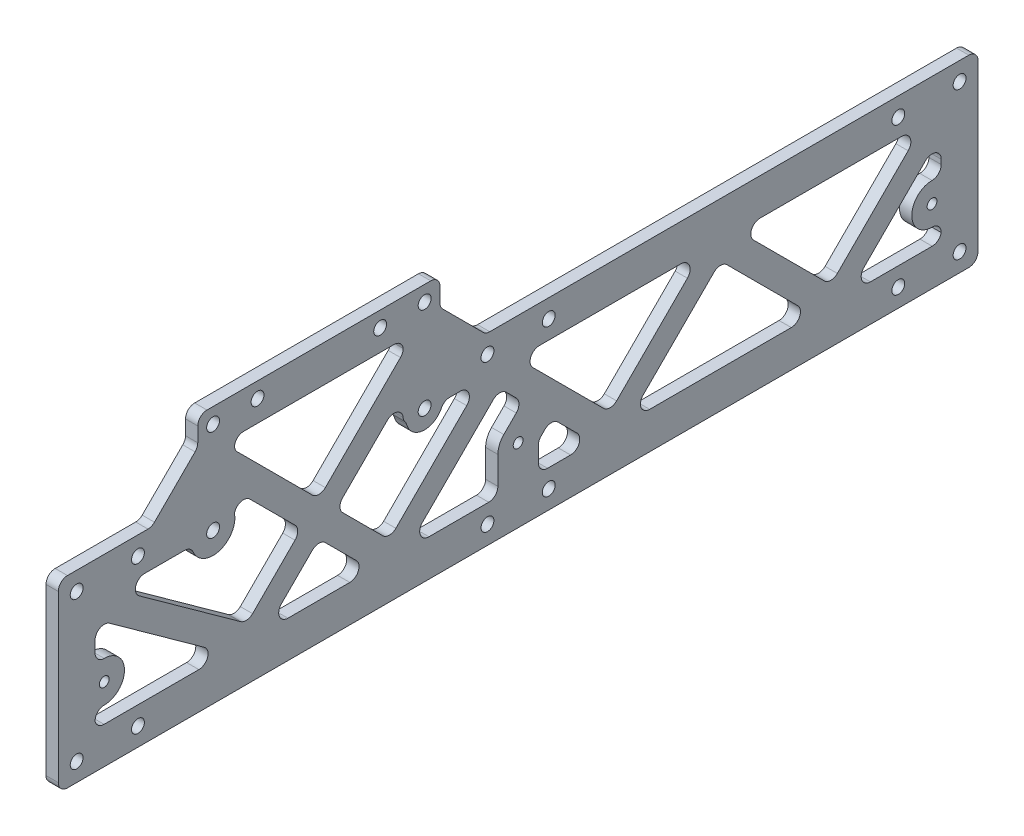
from build123d import *

# Parameters (mm, degrees)
SKETCH_1_W          = 300
SKETCH_1_H          = 60
SKETCH_1_R          = 1.6
SKETCH_1_R_2        = 2.1
EXTRUDE_1_DEPTH     = 4
SKETCH_2_W          = 79
SKETCH_2_H          = 24
SKETCH_2_R          = 2.1
EXTRUDE_2_DEPTH     = 4
SKETCH_2_4_R        = 2.1
CUT_EXTRUDE_1_DEPTH = 4
CUT_EXTRUDE_2_DEPTH = 10
FILLET_1_R          = 3
FILLET_2_R          = 3
FILLET_3_R          = 3
FILLET_4_R          = 3
FILLET_5_R          = 3
CHAMFER_1_SIZE      = 15
FILLET_6_R          = 3
SKETCH_4_R          = 2.1
CUT_EXTRUDE_3_DEPTH = 10


with BuildPart() as part:
    # 草图1 → 凸台-拉伸1 (new body)
    with BuildSketch(Plane(origin=(0, 0, 0), x_dir=(0, 0, -1), z_dir=(1, 0, 0))):
        with Locations((135, 6)):
            Rectangle(SKETCH_1_W, SKETCH_1_H)
        Circle(SKETCH_1_R, mode=Mode.SUBTRACT)
        with Locations((135, 0)):
            Circle(SKETCH_1_R, mode=Mode.SUBTRACT)
        with Locations((270, 0)):
            Circle(SKETCH_1_R, mode=Mode.SUBTRACT)
        with Locations((-9, -18)):
            Circle(SKETCH_1_R_2, mode=Mode.SUBTRACT)
        with Locations((11, -18)):
            Circle(SKETCH_1_R_2, mode=Mode.SUBTRACT)
        with Locations((125, -18)):
            Circle(SKETCH_1_R_2, mode=Mode.SUBTRACT)
        with Locations((145, -18)):
            Circle(SKETCH_1_R_2, mode=Mode.SUBTRACT)
        with Locations((259, -18)):
            Circle(SKETCH_1_R_2, mode=Mode.SUBTRACT)
        with Locations((279, -18)):
            Circle(SKETCH_1_R_2, mode=Mode.SUBTRACT)
        with Locations(Location((279, 30, 0), (0, 0, 180))):
            Circle(SKETCH_1_R_2, mode=Mode.SUBTRACT)
        with Locations(Location((259, 30, 0), (0, 0, 180))):
            Circle(SKETCH_1_R_2, mode=Mode.SUBTRACT)
        with Locations(Location((145, 30, 0), (0, 0, 180))):
            Circle(SKETCH_1_R_2, mode=Mode.SUBTRACT)
        with Locations(Location((125, 30, 0), (0, 0, 180))):
            Circle(SKETCH_1_R_2, mode=Mode.SUBTRACT)
        with Locations(Location((11, 30, 0), (0, 0, 180))):
            Circle(SKETCH_1_R_2, mode=Mode.SUBTRACT)
        with Locations(Location((-9, 30, 0), (0, 0, 180))):
            Circle(SKETCH_1_R_2, mode=Mode.SUBTRACT)
    extrude(amount=EXTRUDE_1_DEPTH)

    # 草图2 → 凸台-拉伸2 (add)
    with BuildSketch(Plane.ZY):
        with Locations((-70, 48)):
            Rectangle(SKETCH_2_W, SKETCH_2_H)
        with Locations((-104.5, 55)):
            Circle(SKETCH_2_R, mode=Mode.SUBTRACT)
        with Locations((-35.5, 55)):
            Circle(SKETCH_2_R, mode=Mode.SUBTRACT)
    extrude(amount=-EXTRUDE_2_DEPTH)

    # 草图2<4> → 切除-拉伸1 (cut)
    with BuildSketch(Plane.ZY):
        with Locations((-104.5, 25)):
            Circle(SKETCH_2_4_R)
        with Locations((-35.5, 25)):
            Circle(SKETCH_2_4_R)
    extrude(amount=-CUT_EXTRUDE_1_DEPTH, mode=Mode.SUBTRACT)

    # 草图3 → 切除-拉伸2 (cut)
    with BuildSketch(Plane.ZY):
        with BuildLine():
            Line((-242.656854249, -12), (-273, 18.343145751))
            Line((-273, 18.343145751), (-273, 5.878775383))
            ThreePointArc((-273, 5.878775383), (-263.4, 0), (-273, -5.878775383))
            Line((-273, -5.878775383), (-273, -12))
            Line((-273, -12), (-242.656854249, -12))
        make_face()
        Polygon((-201, 18.343145751), (-231.343145751, -12), (-170.656854249, -12), align=None)
        Polygon((-206.656854249, 24), (-267.343145751, 24), (-237, -6.343145751), align=None)
        Polygon((-145.838477631, 1.504668119), (-159.343145751, -12), (-141.6, -12), (-141.6, -2.733809512), align=None)
        Polygon((-134.656854249, 24), (-195.343145751, 24), (-165, -6.343145751), align=None)
        with BuildLine():
            Line((-129, 18.343145751), (-136.504668119, 10.838477631))
            Line((-136.504668119, 10.838477631), (-130.333095244, 4.666904756))
            ThreePointArc((-130.333095244, 4.666904756), (-128.902395085, 2.525710654), (-128.4, 0))
            Line((-128.4, 0), (-128.4, -12))
            Line((-128.4, -12), (-98.656854249, -12))
            Line((-98.656854249, -12), (-129, 18.343145751))
        make_face()
        with BuildLine():
            Line((-110.517474553, 24), (-123.343145751, 24))
            Line((-123.343145751, 24), (-93, -6.343145751))
            Line((-93, -6.343145751), (-75.656854249, 11))
            Line((-75.656854249, 11), (-97.5, 32.843145751))
            Line((-97.5, 32.843145751), (-97.5, 24))
            Line((-97.5, 24), (-98.482525447, 24))
            ThreePointArc((-98.482525447, 24), (-104.5, 18.9), (-110.517474553, 24))
        make_face()
        Polygon((-70, 5.343145751), (-87.343145751, -12), (-52.656854249, -12), align=None)
        Polygon((-97.5, 44.156854249), (-70, 16.656854249), (-42.5, 44.156854249), (-42.5, 48), (-97.5, 48), align=None)
        with BuildLine():
            Line((-42.5, 32.843145751), (-64.343145751, 11))
            Line((-64.343145751, 11), (-46.57679112, -6.76635463))
            Line((-46.57679112, -6.76635463), (-3.845743023, 24))
            Line((-3.845743023, 24), (-28.470775292, 24))
            ThreePointArc((-28.470775292, 24), (-36.593814712, 17.984761631), (-42.5, 26.187434209))
            Line((-42.5, 26.187434209), (-42.5, 32.843145751))
        make_face()
        with BuildLine():
            Line((3, 19.071065024), (-40.154256977, -12))
            Line((-40.154256977, -12), (3, -12))
            Line((3, -12), (3, -5.878775383))
            ThreePointArc((3, -5.878775383), (-6.6, 0), (3, 5.878775383))
            Line((3, 5.878775383), (3, 19.071065024))
        make_face()
    extrude(amount=-CUT_EXTRUDE_2_DEPTH, mode=Mode.SUBTRACT)

    # 圆角1
    fillet_1_edges = [part.edges().sort_by_distance(p)[0] for p in [
        (2, 26.187434209, -42.5),
        (2, -6.76635463, -46.57679112),
        (2, -5.878775383, 3),
        (2, 19.071065024, 3),
        (2, 24, -206.656854249),
    ]]
    fillet(fillet_1_edges, radius=FILLET_1_R)

    # 圆角2
    # the kernel refuses this fillet: 3 mm, written as the material it adds along each edge
    with BuildSketch(Plane(origin=(0, -12, 3), x_dir=(0, 1.0, -1.5720758028687154e-12), z_dir=(1, 0, 0))) as fillet_2_piece_1:
        with BuildLine():
            CenterArc((3, -2.939387691), FILLET_2_R, 101.536959033, 78.463040967)
            Line((0, -2.939387691), (-0.06, -2.939387691))
            Line((-0.06, -2.939387691), (-0.06, 0))
            Line((-0.06, 0), (0, 0.06))
            ThreePointArc((0, 0.06), (1.2, 0.06), (2.388, 0.058787754))
            Line((2.388, 0.058787754), (2.4, 0))
        make_face()
    extrude(amount=4)
    with BuildSketch(Plane(origin=(0, 44.156854249, -42.5), x_dir=(0, 1, 0), z_dir=(1, 0, 0))) as fillet_2_piece_2:
        with BuildLine():
            CenterArc((FILLET_2_R * 0.414213562373, -FILLET_2_R), FILLET_2_R, 90, 45)
            Line((-FILLET_2_R * 0.292893218813, -FILLET_2_R * 0.292893218813), (-FILLET_2_R * 0.307035354437, -FILLET_2_R * 0.27875108319))
            Line((-FILLET_2_R * 0.307035354437, -FILLET_2_R * 0.27875108319), (-FILLET_2_R * 0.00828427124746, FILLET_2_R * 0.02))
            Line((-FILLET_2_R * 0.00828427124746, FILLET_2_R * 0.02), (FILLET_2_R * 0.414213562373, FILLET_2_R * 0.02))
            Line((FILLET_2_R * 0.414213562373, FILLET_2_R * 0.02), (FILLET_2_R * 0.414213562373, 0))
        make_face()
    extrude(amount=4)
    with BuildSketch(Plane(origin=(0, 18.343145751, -273), x_dir=(0, -1, 0), z_dir=(1, 0, 0))) as fillet_2_piece_3:
        with BuildLine():
            CenterArc((FILLET_2_R * 2.41421356237, -FILLET_2_R), FILLET_2_R, 90, 135)
            Line((FILLET_2_R * 1.70710678119, -FILLET_2_R * 1.70710678119), (FILLET_2_R * 1.69296464556, -FILLET_2_R * 1.72124891681))
            Line((FILLET_2_R * 1.69296464556, -FILLET_2_R * 1.72124891681), (-FILLET_2_R * 0.0141421356237, -FILLET_2_R * 0.0141421356237))
            Line((-FILLET_2_R * 0.0141421356237, -FILLET_2_R * 0.0141421356237), (0, FILLET_2_R * 0.02))
            Line((0, FILLET_2_R * 0.02), (FILLET_2_R * 2.41421356237, FILLET_2_R * 0.02))
            Line((FILLET_2_R * 2.41421356237, FILLET_2_R * 0.02), (FILLET_2_R * 2.41421356237, 0))
        make_face()
    extrude(amount=4)
    with BuildSketch(Plane(origin=(0, -12, -40.154256977), x_dir=(0, 0, 1), z_dir=(1, 0, 0))) as fillet_2_piece_4:
        with BuildLine():
            CenterArc((FILLET_2_R * 3.10032464453, -FILLET_2_R), FILLET_2_R, 90, 144.246112746)
            Line((FILLET_2_R * 2.51601991868, -FILLET_2_R * 1.81153434145), (FILLET_2_R * 2.50433382417, -FILLET_2_R * 1.82776502828))
            Line((FILLET_2_R * 2.50433382417, -FILLET_2_R * 1.82776502828), (-FILLET_2_R * 0.0116860945169, -FILLET_2_R * 0.016230686829))
            Line((-FILLET_2_R * 0.0116860945169, -FILLET_2_R * 0.016230686829), (0, FILLET_2_R * 0.02))
            Line((0, FILLET_2_R * 0.02), (FILLET_2_R * 3.10032464453, FILLET_2_R * 0.02))
            Line((FILLET_2_R * 3.10032464453, FILLET_2_R * 0.02), (FILLET_2_R * 3.10032464453, 0))
        make_face()
    extrude(amount=4)
    with BuildSketch(Plane(origin=(0, 5.878775383, -273), x_dir=(0, 0.23374821621750477, 0.9722971620935313), z_dir=(1, 0, 0))) as fillet_2_piece_5:
        with BuildLine():
            CenterArc((3.786721103, -2.916891486), FILLET_2_R, 103.517845895, 90)
            Line((0.869829616, -3.618136135), (0.811491787, -3.632161028))
            Line((0.811491787, -3.632161028), (-0.05833783, -0.014024893))
            Line((-0.05833783, -0.014024893), (0.014024893, 0.05833783))
            ThreePointArc((0.014024893, 0.05833783), (1.542738227, -0.12283873), (3.071451561, 0.05833783))
            Line((3.071451561, 0.05833783), (3.085476454, 0))
        make_face()
    extrude(amount=4)
    with BuildSketch(Plane(origin=(0, 44.156854249, -97.5), x_dir=(0, 1, 0), z_dir=(1, 0, 0))) as fillet_2_piece_6:
        with BuildLine():
            CenterArc((FILLET_2_R * 0.414213562373, FILLET_2_R), FILLET_2_R, 225, 45)
            Line((-FILLET_2_R * 0.292893218813, FILLET_2_R * 0.292893218813), (-FILLET_2_R * 0.307035354437, FILLET_2_R * 0.27875108319))
            Line((-FILLET_2_R * 0.307035354437, FILLET_2_R * 0.27875108319), (-FILLET_2_R * 0.00828427124746, -FILLET_2_R * 0.02))
            Line((-FILLET_2_R * 0.00828427124746, -FILLET_2_R * 0.02), (FILLET_2_R * 0.414213562373, -FILLET_2_R * 0.02))
            Line((FILLET_2_R * 0.414213562373, -FILLET_2_R * 0.02), (FILLET_2_R * 0.414213562373, 0))
        make_face()
    extrude(amount=4)

    # 圆角3
    # the kernel refuses this fillet: 3 mm, written as the material it adds along each edge
    with BuildSketch(Plane(origin=(0, 48, -42.5), x_dir=(0, 0, -1), z_dir=(1, 0, 0))) as fillet_3_piece_1:
        with BuildLine():
            CenterArc((2.973281654, -3), FILLET_3_R, 90, 82.347477131)
            Line((0, -2.600505063), (-0.059465633, -2.592515165))
            ThreePointArc((-0.059465633, -2.592515165), (-0.06, -1.300252532), (-0.06, 0))
            Line((-0.06, 0), (0, 0.06))
            Line((0, 0.06), (2.973281654, 0.06))
            Line((2.973281654, 0.06), (2.973281654, 0))
        make_face()
    extrude(amount=4)
    with BuildSketch(Plane(origin=(0, 11, -75.656854249), x_dir=(0, 0.7071067811865517, -0.7071067811865434), z_dir=(1, 0, 0))) as fillet_3_piece_2:
        with BuildLine():
            CenterArc((FILLET_3_R, -FILLET_3_R), FILLET_3_R, 90, 90)
            Line((0, -FILLET_3_R), (-FILLET_3_R * 0.02, -FILLET_3_R))
            Line((-FILLET_3_R * 0.02, -FILLET_3_R), (-FILLET_3_R * 0.02, FILLET_3_R * 0.02))
            Line((-FILLET_3_R * 0.02, FILLET_3_R * 0.02), (FILLET_3_R, FILLET_3_R * 0.02))
            Line((FILLET_3_R, FILLET_3_R * 0.02), (FILLET_3_R, 0))
        make_face()
    extrude(amount=4)
    with BuildSketch(Plane(origin=(0, -12, -242.656854249), x_dir=(0, 0, -1), z_dir=(1, 0, 0))) as fillet_3_piece_3:
        with BuildLine():
            CenterArc((FILLET_3_R * 2.41421356237, FILLET_3_R), FILLET_3_R, 135, 135)
            Line((FILLET_3_R * 1.70710678119, FILLET_3_R * 1.70710678119), (FILLET_3_R * 1.69296464556, FILLET_3_R * 1.72124891681))
            Line((FILLET_3_R * 1.69296464556, FILLET_3_R * 1.72124891681), (-FILLET_3_R * 0.0141421356237, FILLET_3_R * 0.0141421356237))
            Line((-FILLET_3_R * 0.0141421356237, FILLET_3_R * 0.0141421356237), (0, -FILLET_3_R * 0.02))
            Line((0, -FILLET_3_R * 0.02), (FILLET_3_R * 2.41421356237, -FILLET_3_R * 0.02))
            Line((FILLET_3_R * 2.41421356237, -FILLET_3_R * 0.02), (FILLET_3_R * 2.41421356237, 0))
        make_face()
    extrude(amount=4)
    with BuildSketch(Plane(origin=(0, 32.843145751, -97.5), x_dir=(0, -1, 0), z_dir=(1, 0, 0))) as fillet_3_piece_4:
        with BuildLine():
            CenterArc((FILLET_3_R * 2.41421356237, -FILLET_3_R), FILLET_3_R, 90, 135)
            Line((FILLET_3_R * 1.70710678119, -FILLET_3_R * 1.70710678119), (FILLET_3_R * 1.69296464556, -FILLET_3_R * 1.72124891681))
            Line((FILLET_3_R * 1.69296464556, -FILLET_3_R * 1.72124891681), (-FILLET_3_R * 0.0141421356237, -FILLET_3_R * 0.0141421356237))
            Line((-FILLET_3_R * 0.0141421356237, -FILLET_3_R * 0.0141421356237), (0, FILLET_3_R * 0.02))
            Line((0, FILLET_3_R * 0.02), (FILLET_3_R * 2.41421356237, FILLET_3_R * 0.02))
            Line((FILLET_3_R * 2.41421356237, FILLET_3_R * 0.02), (FILLET_3_R * 2.41421356237, 0))
        make_face()
    extrude(amount=4)
    with BuildSketch(Plane(origin=(0, 48, -97.5), x_dir=(0, -1, 0), z_dir=(1, 0, 0))) as fillet_3_piece_5:
        with BuildLine():
            CenterArc((3, -2.973281654), FILLET_3_R, 97.652522869, 82.347477131)
            Line((0, -2.973281654), (-0.06, -2.973281654))
            Line((-0.06, -2.973281654), (-0.06, 0))
            Line((-0.06, 0), (0, 0.06))
            ThreePointArc((0, 0.06), (1.300252532, 0.06), (2.592515165, 0.059465633))
            Line((2.592515165, 0.059465633), (2.600505063, 0))
        make_face()
    extrude(amount=4)

    # 圆角4
    # the kernel refuses this fillet: 3 mm, written as the material it adds along each edge
    with BuildSketch(Plane(origin=(0, 11, -64.343145751), x_dir=(0, 0.7071067811865528, 0.7071067811865421), z_dir=(1, 0, 0)), Plane(origin=(0, 10.838477631, -136.504668119), x_dir=(0, 0.7071067811865538, 0.7071067811865414), z_dir=(1, 0, 0)), Plane(origin=(0, 16.656854249, -70), x_dir=(0, 0.7071067811865522, -0.7071067811865428), z_dir=(1, 0, 0))) as fillet_4_piece_1:
        with BuildLine():
            CenterArc((FILLET_4_R, FILLET_4_R), FILLET_4_R, 180, 90)
            Line((0, FILLET_4_R), (-FILLET_4_R * 0.02, FILLET_4_R))
            Line((-FILLET_4_R * 0.02, FILLET_4_R), (-FILLET_4_R * 0.02, -FILLET_4_R * 0.02))
            Line((-FILLET_4_R * 0.02, -FILLET_4_R * 0.02), (FILLET_4_R, -FILLET_4_R * 0.02))
            Line((FILLET_4_R, -FILLET_4_R * 0.02), (FILLET_4_R, 0))
        make_face()
    extrude(amount=4)
    with BuildSketch(Plane(origin=(0, -6.343145751, -165), x_dir=(0, 0.7071067811865535, 0.7071067811865416), z_dir=(1, 0, 0)), Plane(origin=(0, 18.343145751, -201), x_dir=(0, -0.7071067811865523, -0.7071067811865428), z_dir=(1, 0, 0)), Plane(origin=(0, -12, -128.4), x_dir=(0, 0, 1), z_dir=(1, 0, 0)), Plane(origin=(0, -6.343145751, -93), x_dir=(0, 0.707106781186554, 0.7071067811865409), z_dir=(1, 0, 0))) as fillet_4_piece_2:
        with BuildLine():
            CenterArc((FILLET_4_R, -FILLET_4_R), FILLET_4_R, 90, 90)
            Line((0, -FILLET_4_R), (-FILLET_4_R * 0.02, -FILLET_4_R))
            Line((-FILLET_4_R * 0.02, -FILLET_4_R), (-FILLET_4_R * 0.02, FILLET_4_R * 0.02))
            Line((-FILLET_4_R * 0.02, FILLET_4_R * 0.02), (FILLET_4_R, FILLET_4_R * 0.02))
            Line((FILLET_4_R, FILLET_4_R * 0.02), (FILLET_4_R, 0))
        make_face()
    extrude(amount=4)
    with BuildSketch(Plane(origin=(0, 32.843145751, -42.5), x_dir=(0, -1, 0), z_dir=(1, 0, 0))) as fillet_4_piece_3:
        with BuildLine():
            CenterArc((7.153056137, 2.91041545), FILLET_4_R, 135, 120.962807656)
            Line((5.031735794, 5.031735794), (4.989309387, 5.074162201))
            Line((4.989309387, 5.074162201), (-0.042426407, 0.042426407))
            Line((-0.042426407, 0.042426407), (0, -0.06))
            ThreePointArc((0, -0.06), (3.212700531, -0.06), (6.410847961, -0.058208309))
            Line((6.410847961, -0.058208309), (6.425401063, 0))
        make_face()
    extrude(amount=4)
    with BuildSketch(Plane(origin=(0, -5.878775383, -273), x_dir=(0, -1, 0), z_dir=(1, 0, 0))) as fillet_4_piece_4:
        with BuildLine():
            CenterArc((3.721224617, -3), FILLET_4_R, 90, 90)
            Line((0.721224617, -3), (0.661224617, -3))
            ThreePointArc((0.661224617, -3), (0.480048057, -1.471286666), (-0.053443413, -0.027272727))
            Line((-0.053443413, -0.027272727), (0, 0.06))
            Line((0, 0.06), (3.721224617, 0.06))
            Line((3.721224617, 0.06), (3.721224617, 0))
        make_face()
    extrude(amount=4)
    with BuildSketch(Plane(origin=(0, 24, -110.517474553), x_dir=(0, -0.9523660579000247, 0.30495719660301), z_dir=(1, 0, 0))) as fillet_4_piece_5:
        with BuildLine():
            CenterArc((2.199529985, 2.968424122), FILLET_4_R, 197.755588771, 63.924161181)
            Line((-0.657568188, 2.053552533), (-0.714710152, 2.035255101))
            Line((-0.714710152, 2.035255101), (-0.057141963, -0.018297432))
            Line((-0.057141963, -0.018297432), (0.008682355, -0.059368482))
            ThreePointArc((0.008682355, -0.059368482), (0.882706113, 0.004204285), (1.75672987, -0.059368482))
            Line((1.75672987, -0.059368482), (1.765412225, 0))
        make_face()
    extrude(amount=4)
    with BuildSketch(Plane(origin=(0, 24, -123.343145751), x_dir=(0, 0, 1), z_dir=(1, 0, 0))) as fillet_4_piece_6:
        with BuildLine():
            CenterArc((FILLET_4_R * 2.41421356237, FILLET_4_R), FILLET_4_R, 135, 135)
            Line((FILLET_4_R * 1.70710678119, FILLET_4_R * 1.70710678119), (FILLET_4_R * 1.69296464556, FILLET_4_R * 1.72124891681))
            Line((FILLET_4_R * 1.69296464556, FILLET_4_R * 1.72124891681), (-FILLET_4_R * 0.0141421356237, FILLET_4_R * 0.0141421356237))
            Line((-FILLET_4_R * 0.0141421356237, FILLET_4_R * 0.0141421356237), (0, -FILLET_4_R * 0.02))
            Line((0, -FILLET_4_R * 0.02), (FILLET_4_R * 2.41421356237, -FILLET_4_R * 0.02))
            Line((FILLET_4_R * 2.41421356237, -FILLET_4_R * 0.02), (FILLET_4_R * 2.41421356237, 0))
        make_face()
    extrude(amount=4)
    with BuildSketch(Plane(origin=(0, 24, -267.343145751), x_dir=(0, -0.7071067811865421, 0.7071067811865529), z_dir=(1, 0, 0))) as fillet_4_piece_7:
        with BuildLine():
            CenterArc((FILLET_4_R * 2.41421356237, -FILLET_4_R), FILLET_4_R, 90, 135)
            Line((FILLET_4_R * 1.70710678119, -FILLET_4_R * 1.70710678119), (FILLET_4_R * 1.69296464556, -FILLET_4_R * 1.72124891681))
            Line((FILLET_4_R * 1.69296464556, -FILLET_4_R * 1.72124891681), (-FILLET_4_R * 0.0141421356237, -FILLET_4_R * 0.0141421356237))
            Line((-FILLET_4_R * 0.0141421356237, -FILLET_4_R * 0.0141421356237), (0, FILLET_4_R * 0.02))
            Line((0, FILLET_4_R * 0.02), (FILLET_4_R * 2.41421356237, FILLET_4_R * 0.02))
            Line((FILLET_4_R * 2.41421356237, FILLET_4_R * 0.02), (FILLET_4_R * 2.41421356237, 0))
        make_face()
    extrude(amount=4)
    # the kernel refuses this fillet: 3 mm, written as the material it takes off along each edge
    with BuildSketch(Plane(origin=(-4.815889323, 24, -97.5), x_dir=(0, 0.9999575952432413, 0.009209110454001522), z_dir=(1, 0, 0))) as fillet_4_2_piece_1:
        with BuildLine():
            CenterArc((2.224646932, -2.985133558), FILLET_4_R, 95.706371394, 42.415381295)
            Line((-0.009048185, -0.982483783), (-0.232417697, -0.782218805))
            ThreePointArc((-0.232417697, -0.782218805), (-0.304511371, -0.488479158), (-0.299987279, 0.002762733))
            Line((-0.299987279, 0.002762733), (0.002762733, 0.299987279))
            ThreePointArc((0.002762733, 0.299987279), (1.603199928, 0.285248051), (1.896526609, 0.298513356))
            Line((1.896526609, 0.298513356), (1.926355729, 0))
        make_face()
    extrude(amount=13.631778645, mode=Mode.SUBTRACT)

    # 圆角5
    # the kernel refuses this fillet: 3 mm, written as the material it adds along each edge
    with BuildSketch(Plane(origin=(0, -12, -273), x_dir=(0, 0, 1), z_dir=(1, 0, 0))) as fillet_5_piece_1:
        with BuildLine():
            CenterArc((2.939387691, -3), FILLET_5_R, 90, 78.463040967)
            Line((0, -2.4), (-0.058787754, -2.388))
            ThreePointArc((-0.058787754, -2.388), (-0.06, -1.2), (-0.06, 0))
            Line((-0.06, 0), (0, 0.06))
            Line((0, 0.06), (2.939387691, 0.06))
            Line((2.939387691, 0.06), (2.939387691, 0))
        make_face()
    extrude(amount=4)
    with BuildSketch(Plane(origin=(0, 24, -195.343145751), x_dir=(0, -0.7071067811865444, 0.7071067811865507), z_dir=(1, 0, 0)), Plane(origin=(0, -12, -87.343145751), x_dir=(0, 0, 1), z_dir=(1, 0, 0)), Plane(origin=(0, -12, -231.343145751), x_dir=(0, 0, 1), z_dir=(1, 0, 0))) as fillet_5_piece_2:
        with BuildLine():
            CenterArc((FILLET_5_R * 2.41421356237, -FILLET_5_R), FILLET_5_R, 90, 135)
            Line((FILLET_5_R * 1.70710678119, -FILLET_5_R * 1.70710678119), (FILLET_5_R * 1.69296464556, -FILLET_5_R * 1.72124891681))
            Line((FILLET_5_R * 1.69296464556, -FILLET_5_R * 1.72124891681), (-FILLET_5_R * 0.0141421356237, -FILLET_5_R * 0.0141421356237))
            Line((-FILLET_5_R * 0.0141421356237, -FILLET_5_R * 0.0141421356237), (0, FILLET_5_R * 0.02))
            Line((0, FILLET_5_R * 0.02), (FILLET_5_R * 2.41421356237, FILLET_5_R * 0.02))
            Line((FILLET_5_R * 2.41421356237, FILLET_5_R * 0.02), (FILLET_5_R * 2.41421356237, 0))
        make_face()
    extrude(amount=4)
    with BuildSketch(Plane(origin=(0, -6.343145751, -237), x_dir=(0, 0.7071067811865446, -0.7071067811865505), z_dir=(1, 0, 0)), Plane(origin=(0, -12, -141.6), x_dir=(0, 0, -1), z_dir=(1, 0, 0)), Plane(origin=(0, 18.343145751, -129), x_dir=(0, -0.7071067811865387, 0.7071067811865565), z_dir=(1, 0, 0))) as fillet_5_piece_3:
        with BuildLine():
            CenterArc((FILLET_5_R, FILLET_5_R), FILLET_5_R, 180, 90)
            Line((0, FILLET_5_R), (-FILLET_5_R * 0.02, FILLET_5_R))
            Line((-FILLET_5_R * 0.02, FILLET_5_R), (-FILLET_5_R * 0.02, -FILLET_5_R * 0.02))
            Line((-FILLET_5_R * 0.02, -FILLET_5_R * 0.02), (FILLET_5_R, -FILLET_5_R * 0.02))
            Line((FILLET_5_R, -FILLET_5_R * 0.02), (FILLET_5_R, 0))
        make_face()
    extrude(amount=4)
    with BuildSketch(Plane(origin=(0, -12, -52.656854249), x_dir=(0, 0, -1), z_dir=(1, 0, 0)), Plane(origin=(0, 24, -134.656854249), x_dir=(0, -0.7071067811865512, -0.7071067811865439), z_dir=(1, 0, 0)), Plane(origin=(0, -12, -159.343145751), x_dir=(0, 0.7071067811865517, 0.7071067811865435), z_dir=(1, 0, 0)), Plane(origin=(0, -12, -98.656854249), x_dir=(0, 0, -1), z_dir=(1, 0, 0)), Plane(origin=(0, -12, -170.656854249), x_dir=(0, 0, -1), z_dir=(1, 0, 0))) as fillet_5_piece_4:
        with BuildLine():
            CenterArc((FILLET_5_R * 2.41421356237, FILLET_5_R), FILLET_5_R, 135, 135)
            Line((FILLET_5_R * 1.70710678119, FILLET_5_R * 1.70710678119), (FILLET_5_R * 1.69296464556, FILLET_5_R * 1.72124891681))
            Line((FILLET_5_R * 1.69296464556, FILLET_5_R * 1.72124891681), (-FILLET_5_R * 0.0141421356237, FILLET_5_R * 0.0141421356237))
            Line((-FILLET_5_R * 0.0141421356237, FILLET_5_R * 0.0141421356237), (0, -FILLET_5_R * 0.02))
            Line((0, -FILLET_5_R * 0.02), (FILLET_5_R * 2.41421356237, -FILLET_5_R * 0.02))
            Line((FILLET_5_R * 2.41421356237, -FILLET_5_R * 0.02), (FILLET_5_R * 2.41421356237, 0))
        make_face()
    extrude(amount=4)
    with BuildSketch(Plane(origin=(0, -2.733809512, -141.6), x_dir=(0, 0.7071067811865461, -0.707106781186549), z_dir=(1, 0, 0))) as fillet_5_piece_5:
        with BuildLine():
            CenterArc((FILLET_5_R * 0.414213562373, -FILLET_5_R), FILLET_5_R, 90, 45)
            Line((-FILLET_5_R * 0.292893218813, -FILLET_5_R * 0.292893218813), (-FILLET_5_R * 0.307035354437, -FILLET_5_R * 0.27875108319))
            Line((-FILLET_5_R * 0.307035354437, -FILLET_5_R * 0.27875108319), (-FILLET_5_R * 0.00828427124746, FILLET_5_R * 0.02))
            Line((-FILLET_5_R * 0.00828427124746, FILLET_5_R * 0.02), (FILLET_5_R * 0.414213562373, FILLET_5_R * 0.02))
            Line((FILLET_5_R * 0.414213562373, FILLET_5_R * 0.02), (FILLET_5_R * 0.414213562373, 0))
        make_face()
    extrude(amount=4)
    with BuildSketch(Plane(origin=(0, 24, -3.845743023), x_dir=(0, 0, -1), z_dir=(1, 0, 0))) as fillet_5_piece_6:
        with BuildLine():
            CenterArc((FILLET_5_R * 3.10032464453, -FILLET_5_R), FILLET_5_R, 90, 144.246112746)
            Line((FILLET_5_R * 2.51601991868, -FILLET_5_R * 1.81153434145), (FILLET_5_R * 2.50433382417, -FILLET_5_R * 1.82776502828))
            Line((FILLET_5_R * 2.50433382417, -FILLET_5_R * 1.82776502828), (-FILLET_5_R * 0.0116860945169, -FILLET_5_R * 0.016230686829))
            Line((-FILLET_5_R * 0.0116860945169, -FILLET_5_R * 0.016230686829), (0, FILLET_5_R * 0.02))
            Line((0, FILLET_5_R * 0.02), (FILLET_5_R * 3.10032464453, FILLET_5_R * 0.02))
            Line((FILLET_5_R * 3.10032464453, FILLET_5_R * 0.02), (FILLET_5_R * 3.10032464453, 0))
        make_face()
    extrude(amount=4)
    with BuildSketch(Plane(origin=(0, 5.343145751, -70), x_dir=(0, -0.7071067811865512, -0.7071067811865437), z_dir=(1, 0, 0)), Plane(origin=(0, 1.504668119, -145.838477631), x_dir=(0, -0.7071067811865428, -0.7071067811865523), z_dir=(1, 0, 0))) as fillet_5_piece_7:
        with BuildLine():
            CenterArc((FILLET_5_R, -FILLET_5_R), FILLET_5_R, 90, 90)
            Line((0, -FILLET_5_R), (-FILLET_5_R * 0.02, -FILLET_5_R))
            Line((-FILLET_5_R * 0.02, -FILLET_5_R), (-FILLET_5_R * 0.02, FILLET_5_R * 0.02))
            Line((-FILLET_5_R * 0.02, FILLET_5_R * 0.02), (FILLET_5_R, FILLET_5_R * 0.02))
            Line((FILLET_5_R, FILLET_5_R * 0.02), (FILLET_5_R, 0))
        make_face()
    extrude(amount=4)
    with BuildSketch(Plane(origin=(0, 24, -28.470775292), x_dir=(0, -0.9626265971500402, -0.27083211489654285), z_dir=(1, 0, 0))) as fillet_5_piece_8:
        with BuildLine():
            CenterArc((2.279879857, -2.973528497), FILLET_5_R, 97.617038757, 66.669172717)
            Line((-0.607999935, -2.161032152), (-0.665757531, -2.144782226))
            Line((-0.665757531, -2.144782226), (-0.057757596, 0.016249927))
            Line((-0.057757596, 0.016249927), (0.007953069, 0.05947057))
            ThreePointArc((0.007953069, 0.05947057), (0.941113197, -0.002649224), (1.874273324, 0.05947057))
            Line((1.874273324, 0.05947057), (1.882226393, 0))
        make_face()
    extrude(amount=4)
    with BuildSketch(Plane(origin=(0, 5.878775383, 3), x_dir=(0, 0.2337482162175562, -0.972297162093519), z_dir=(1, 0, 0))) as fillet_5_piece_9:
        with BuildLine():
            CenterArc((3.786721103, 2.916891486), FILLET_5_R, 166.482154105, 90)
            Line((0.869829616, 3.618136135), (0.811491787, 3.632161028))
            Line((0.811491787, 3.632161028), (-0.05833783, 0.014024893))
            Line((-0.05833783, 0.014024893), (0.014024893, -0.05833783))
            ThreePointArc((0.014024893, -0.05833783), (1.542738227, 0.12283873), (3.071451561, -0.05833783))
            Line((3.071451561, -0.05833783), (3.085476454, 0))
        make_face()
    extrude(amount=4)
    with BuildSketch(Plane(origin=(0, 24, -98.482525447), x_dir=(0, 0.7278665010974722, 0.6857188611815512), z_dir=(1, 0, 0))) as fillet_5_piece_10:
        with BuildLine():
            CenterArc((0.840286972, 2.986895784), FILLET_5_R, 242.238444493, 22.404319959)
            Line((-0.557092017, 0.332214643), (-0.585039597, 0.27912102))
            ThreePointArc((-0.585039597, 0.27912102), (-0.304858075, 0.121984516), (-0.033427173, -0.049825938))
            Line((-0.033427173, -0.049825938), (0.005601913, -0.059737916))
            ThreePointArc((0.005601913, -0.059737916), (0.280095657, -0.046895784), (0.554589402, -0.059737916))
            Line((0.554589402, -0.059737916), (0.560191315, 0))
        make_face()
    extrude(amount=4)

    # 倒角1
    chamfer_1_edges = [part.edges().sort_by_distance(p)[0] for p in [
        (2, 36, -30.5),
        (2, 36, -109.5),
    ]]
    chamfer(chamfer_1_edges, length=CHAMFER_1_SIZE)

    # 圆角6
    fillet_6_edges = [part.edges().sort_by_distance(p)[0] for p in [
        (2, 36, -15.5),
        (2, 51, -30.5),
        (2, 51, -109.5),
        (2, 36, -124.5),
        (2, 36, 15),
        (2, 36, -285),
        (2, -24, -285),
        (2, 60, -30.5),
        (2, -24, 15),
        (2, 60, -109.5),
    ]]
    fillet(fillet_6_edges, radius=FILLET_6_R)

    # 草图4 → 切除-拉伸3 (cut)
    with BuildSketch(Plane.ZY):
        with Locations((-90, 55)):
            Circle(SKETCH_4_R)
        with Locations((-50, 55)):
            Circle(SKETCH_4_R)
    extrude(amount=-CUT_EXTRUDE_3_DEPTH, mode=Mode.SUBTRACT)


solid = part.part
